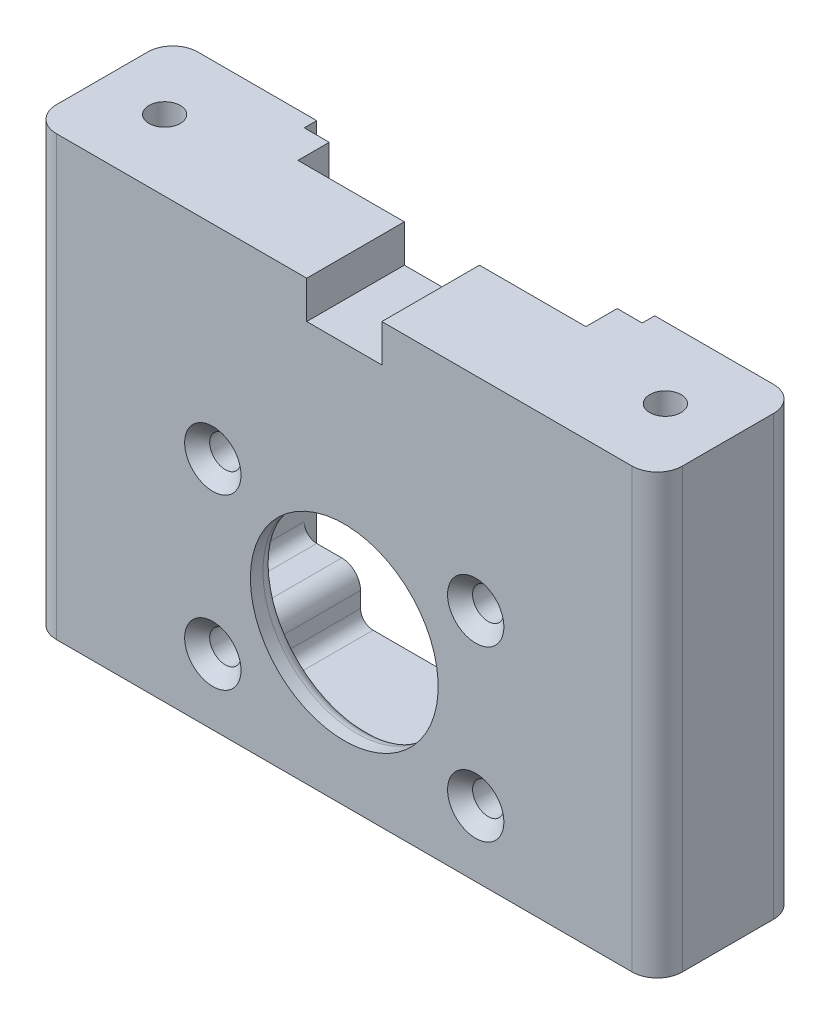
from build123d import *

# Parameters (mm, degrees)
SKETCH_1_W             = 50
SKETCH_1_H             = 35
EXTRUDE_445_DEPTH      = 11.3
SKETCH_2_R             = 7.5
SKETCH_2_R_2           = 1.25
CUT_EXTRUDE_665_DEPTH  = 36.800698317
CUT_EXTRUDE_1135_DEPTH = 9.3
SKETCH_4_W             = 27
SKETCH_4_H             = 34.5
CUT_EXTRUDE_1595_DEPTH = 1
SKETCH_5_W             = 23
SKETCH_5_H             = 3.5
CUT_EXTRUDE_1822_DEPTH = 12.75
FILLET_1_R             = 1
FILLET_3_R             = 1
SKETCH_7_R             = 1.25
CUT_EXTRUDE_3943_DEPTH = 45.471226653
SKETCH_8_W             = 6
SKETCH_8_H             = 7.8
CUT_EXTRUDE_4259_DEPTH = 3
CHAMFER_1_SIZE         = 1
FILLET_2_R             = 2


with BuildPart() as part:
    # Эскиз1 → Extrude 445 (new body)
    with BuildSketch(Plane.XY):
        with Locations((0, 5.5)):
            Rectangle(SKETCH_1_W, SKETCH_1_H)
    extrude(amount=EXTRUDE_445_DEPTH)

    # Эскиз2 → Cut-Extrude 665 (cut, through all)
    with BuildSketch(Plane(origin=(0, 0, 0), x_dir=(-1, 0, 0), z_dir=(0, 0, -1))):
        Circle(SKETCH_2_R)
        with Locations((-10.5, 6.75)):
            Circle(SKETCH_2_R_2)
        with Locations((10.5, 6.75)):
            Circle(SKETCH_2_R_2)
        with Locations((10.5, -6.75)):
            Circle(SKETCH_2_R_2)
        with Locations((-10.5, -6.75)):
            Circle(SKETCH_2_R_2)
    extrude(amount=-CUT_EXTRUDE_665_DEPTH, mode=Mode.SUBTRACT)

    # Эскиз3 → Cut-Extrude 1135 (cut)
    with BuildSketch(Plane(origin=(0, 0, 0), x_dir=(-1, 0, 0), z_dir=(0, 0, -1))):
        with BuildLine():
            Line((-13.5, 10.25), (13.5, 10.25))
            Line((13.5, 10.25), (13.5, 8.25))
            Line((13.5, 8.25), (10.5, 8.25))
            ThreePointArc((10.5, 8.25), (9, 6.75), (10.5, 5.25))
            Line((10.5, 5.25), (13.5, 5.25))
            Line((13.5, 5.25), (13.5, -5.25))
            Line((13.5, -5.25), (10.5, -5.25))
            ThreePointArc((10.5, -5.25), (9.439339828, -5.689339828), (9, -6.75))
            Line((9, -6.75), (9, -9))
            Line((9, -9), (-9, -9))
            Line((-9, -9), (-9, -6.75))
            ThreePointArc((-9, -6.75), (-9.439339828, -5.689339828), (-10.5, -5.25))
            Line((-10.5, -5.25), (-13.5, -5.25))
            Line((-13.5, -5.25), (-13.5, 5.25))
            Line((-13.5, 5.25), (-10.5, 5.25))
            ThreePointArc((-10.5, 5.25), (-9, 6.75), (-10.5, 8.25))
            Line((-10.5, 8.25), (-13.5, 8.25))
            Line((-13.5, 8.25), (-13.5, 10.25))
        make_face()
    extrude(amount=-CUT_EXTRUDE_1135_DEPTH, mode=Mode.SUBTRACT)

    # Эскиз4 → Cut-Extrude 1595 (cut)
    with BuildSketch(Plane(origin=(0, 0, 0), x_dir=(-1, 0, 0), z_dir=(0, 0, -1))):
        with Locations((0, 5.75)):
            Rectangle(SKETCH_4_W, SKETCH_4_H)
    extrude(amount=-CUT_EXTRUDE_1595_DEPTH, mode=Mode.SUBTRACT)

    # Эскиз5 → Cut-Extrude 1822 (cut)
    with BuildSketch(Plane(origin=(0, 23, 0), x_dir=(1, 0, 0), z_dir=(0, 1, 0))):
        with Locations((0, -1.75)):
            Rectangle(SKETCH_5_W, SKETCH_5_H)
    extrude(amount=-CUT_EXTRUDE_1822_DEPTH, mode=Mode.SUBTRACT)

    # Скругление1
    fillet_1_edges = [part.edges().sort_by_distance(p)[0] for p in [
        (0, 10.25, 3.5),
        (7.5, 0, 9.3),
    ]]
    fillet(fillet_1_edges, radius=FILLET_1_R)

    # Скругление3
    fillet_3_edges = [part.edges().sort_by_distance(p)[0] for p in [
        (13.5, 9.25, 9.3),
        (13.5, 8.25, 5.15),
        (0, 10.25, 9.3),
        (-13.5, 9.25, 9.3),
        (-12, 8.25, 9.3),
        (-13.5, 8.25, 5.15),
        (-9, 6.75, 9.3),
        (-12, 5.25, 9.3),
        (-13.5, 0, 9.3),
        (-13.5, 5.25, 5.15),
        (-12, -5.25, 9.3),
        (-13.5, -5.25, 5.15),
        (-9.439339828, -5.689339828, 9.3),
        (-9, -7.875, 9.3),
        (0, -9, 9.3),
        (-9, -9, 5.15),
        (9, -7.875, 9.3),
        (9, -9, 5.15),
        (9.439339828, -5.689339828, 9.3),
        (12, -5.25, 9.3),
        (13.5, 0, 9.3),
        (13.5, -5.25, 5.15),
        (12, 5.25, 9.3),
        (13.5, 5.25, 5.15),
        (9, 6.75, 9.3),
        (12, 8.25, 9.3),
    ]]
    fillet(fillet_3_edges, radius=FILLET_3_R - 0.0001)  # a hair under: the kernel refuses the full size

    # Эскиз7 → Cut-Extrude 3943 (cut, through all)
    with BuildSketch(Plane(origin=(0, 23, 0), x_dir=(1, 0, 0), z_dir=(0, 1, 0))):
        with Locations(Location((-20, -5.65, 0), (0, 0, 180))):
            Circle(SKETCH_7_R)
        with Locations(Location((20, -5.65, 0), (0, 0, 180))):
            Circle(SKETCH_7_R)
    extrude(amount=-CUT_EXTRUDE_3943_DEPTH, mode=Mode.SUBTRACT)

    # Эскиз8 → Cut-Extrude 4259 (cut)
    with BuildSketch(Plane(origin=(0, 23, 0), x_dir=(1, 0, 0), z_dir=(0, 1, 0))):
        with Locations((0, -7.4)):
            Rectangle(SKETCH_8_W, SKETCH_8_H)
    extrude(amount=-CUT_EXTRUDE_4259_DEPTH, mode=Mode.SUBTRACT)

    # Фаска1
    chamfer_1_edges = [part.edges().sort_by_distance(p)[0] for p in [
        (11.75, 6.75, 11.3),
        (-9.25, 6.75, 11.3),
        (-9.25, -6.75, 11.3),
        (11.75, -6.75, 11.3),
    ]]
    chamfer(chamfer_1_edges, length=CHAMFER_1_SIZE)

    # Скругление2
    fillet_2_edges = [part.edges().sort_by_distance(p)[0] for p in [
        (25, 5.5, 11.3),
        (-25, 5.5, 11.3),
        (25, 5.5, 0),
        (-25, 5.5, 0),
    ]]
    fillet(fillet_2_edges, radius=FILLET_2_R)


solid = part.part
